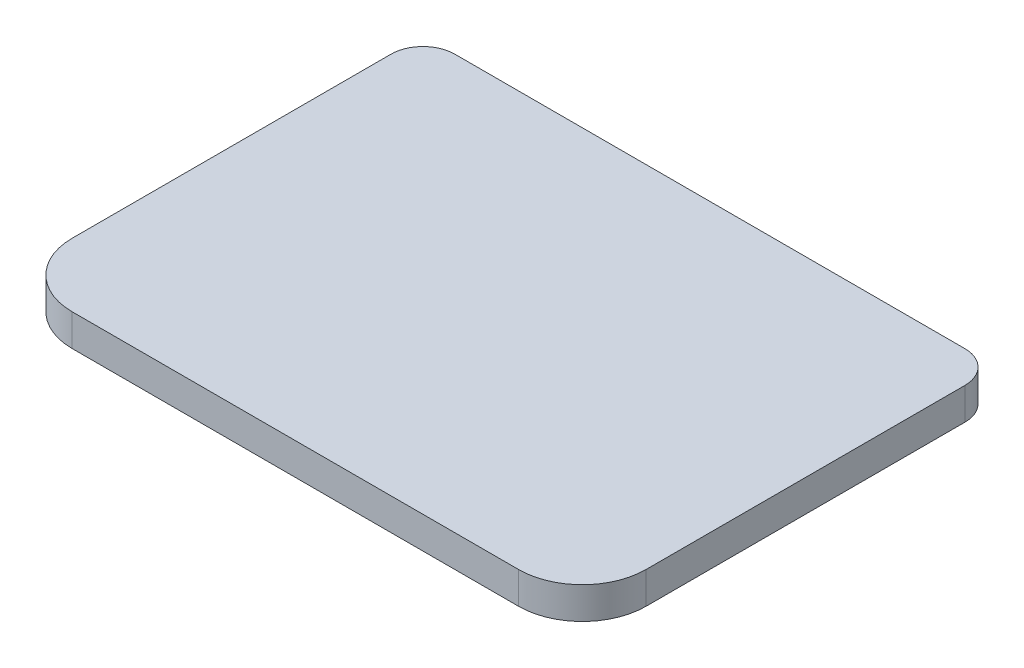
from build123d import *

# Parameters (mm, degrees)
SKETCH1_W           = 57.15
SKETCH1_H           = 41.275
BOSS_EXTRUDE1_DEPTH = 3.175
FILLET1_R           = 6.35
FILLET2_R           = 3.175


with BuildPart() as part:
    # Sketch1 → Boss-Extrude1 (new body)
    with BuildSketch(Plane(origin=(0, 0, 0), x_dir=(1, 0, 0), z_dir=(0, 1, 0))):
        Rectangle(SKETCH1_W, SKETCH1_H)
    extrude(amount=BOSS_EXTRUDE1_DEPTH)

    # Fillet1
    fillet1_edges = [part.edges().sort_by_distance(p)[0] for p in [
        (28.575, 1.5875, 20.6375),
        (-28.575, 1.5875, 20.6375),
    ]]
    fillet(fillet1_edges, radius=FILLET1_R)

    # Fillet2
    fillet2_edges = [part.edges().sort_by_distance(p)[0] for p in [
        (28.575, 1.5875, -20.6375),
        (-28.575, 1.5875, -20.6375),
    ]]
    fillet(fillet2_edges, radius=FILLET2_R)


solid = part.part
